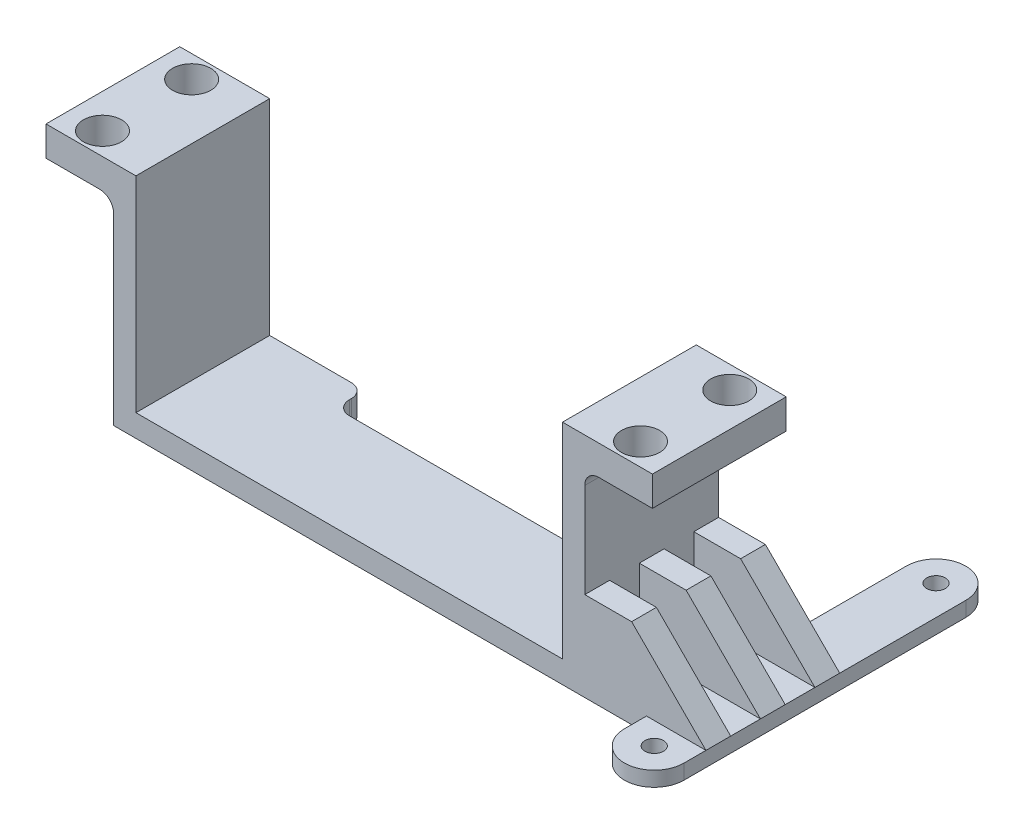
from build123d import *

# Parameters (mm, degrees)
BOSS_EXTRUDE1_DEPTH = 22.86
SKETCH2_R           = 1.5875
BOSS_EXTRUDE2_DEPTH = 2.54
SKETCH4_W           = 15.367
SKETCH4_H           = 22.86
SKETCH4_R           = 3.2639
BOSS_EXTRUDE3_DEPTH = 5.08
SKETCH5_W           = 20.701
SKETCH5_H           = 4.233333333
SKETCH5_H_2         = 4.233333334
BOSS_EXTRUDE4_DEPTH = 12.7
CHAMFER1_SIZE       = 12.7
FILLET1_R           = 2.38
SKETCH6_W           = 50.8
SKETCH6_H           = 5.08
CUT_EXTRUDE1_DEPTH  = 110.560976655
FILLET2_R           = 2.38


with BuildPart() as part:
    # Sketch1 → Boss-Extrude1 (new body)
    with BuildSketch(Plane.XY):
        Polygon((-3.81, 35.052), (0, 35.052), (0, 0), (72.898, 0), (72.898, 35.052), (76.708, 35.052), (76.708, -3.81), (-3.81, -3.81), align=None)
    extrude(amount=BOSS_EXTRUDE1_DEPTH)

    # Sketch2 → Boss-Extrude2 (add)
    with BuildSketch(Plane.XZ.offset(3.81)):
        with BuildLine():
            Line((87.249, 26.6192), (87.249, 22.86))
            Line((87.249, 22.86), (76.708, 22.86))
            Line((76.708, 22.86), (76.708, 0))
            Line((76.708, 0), (87.249, 0))
            Line((87.249, 0), (87.249, -21.5392))
            ThreePointArc((87.249, -21.5392), (92.329, -26.6192), (97.409, -21.5392))
            Line((97.409, -21.5392), (97.409, 26.6192))
            ThreePointArc((97.409, 26.6192), (92.329, 31.6992), (87.249, 26.6192))
        make_face()
        with Locations((92.329, 26.6192)):
            Circle(SKETCH2_R, mode=Mode.SUBTRACT)
        with Locations((92.329, -21.5392)):
            Circle(SKETCH2_R, mode=Mode.SUBTRACT)
    extrude(amount=-BOSS_EXTRUDE2_DEPTH)

    # Sketch4 → Boss-Extrude3 (add)
    with BuildSketch(Plane(origin=(0, 35.052, 0), x_dir=(1, 0, 0), z_dir=(0, 1, 0))):
        with Locations((-7.6835, -11.43)):
            Rectangle(SKETCH4_W, SKETCH4_H)
        with Locations((-9.525, -3.81)):
            Circle(SKETCH4_R, mode=Mode.SUBTRACT)
        with Locations((-9.525, -19.05)):
            Circle(SKETCH4_R, mode=Mode.SUBTRACT)
    boss_extrude3 = extrude(amount=-BOSS_EXTRUDE3_DEPTH)

    # Mirror1: Boss-Extrude3 across plane
    add(boss_extrude3.mirror(Plane(origin=(36.449, 0, 0), x_dir=(0, 0, 1), z_dir=(1, 0, 0))))

    # Sketch5 → Boss-Extrude4 (add)
    with BuildSketch(Plane(origin=(0, -1.27, 0), x_dir=(1, 0, 0), z_dir=(0, 1, 0))):
        with Locations((87.0585, -2.116666667)):
            Rectangle(SKETCH5_W, SKETCH5_H)
        with Locations((87.0585, -20.743333334)):
            Rectangle(SKETCH5_W, SKETCH5_H)
        with Locations((87.0585, -11.43)):
            Rectangle(SKETCH5_W, SKETCH5_H_2)
    extrude(amount=BOSS_EXTRUDE4_DEPTH)

    # Chamfer1
    chamfer1_edges = [part.edges().sort_by_distance(p)[0] for p in [
        (97.409, 11.43, 20.743333333),
        (97.409, 11.43, 11.43),
        (97.409, 11.43, 2.116666667),
    ]]
    chamfer(chamfer1_edges, length=CHAMFER1_SIZE)

    # Fillet1
    fillet1_edges = [part.edges().sort_by_distance(p)[0] for p in [
        (76.708, 29.972, 11.43),
        (-3.81, 29.972, 11.43),
    ]]
    fillet(fillet1_edges, radius=FILLET1_R)

    # Sketch6 → Cut-Extrude1 (cut, through all)
    with BuildSketch(Plane.XZ.offset(3.81)):
        with Locations((41.7195, 2.54)):
            Rectangle(SKETCH6_W, SKETCH6_H)
    extrude(amount=-CUT_EXTRUDE1_DEPTH, mode=Mode.SUBTRACT)

    # Fillet2
    fillet2_edges = [part.edges().sort_by_distance(p)[0] for p in [
        (67.1195, -1.905, 0),
        (67.1195, -1.905, 5.08),
        (16.3195, -1.905, 0),
        (16.3195, -1.905, 5.08),
    ]]
    fillet(fillet2_edges, radius=FILLET2_R)


solid = part.part
